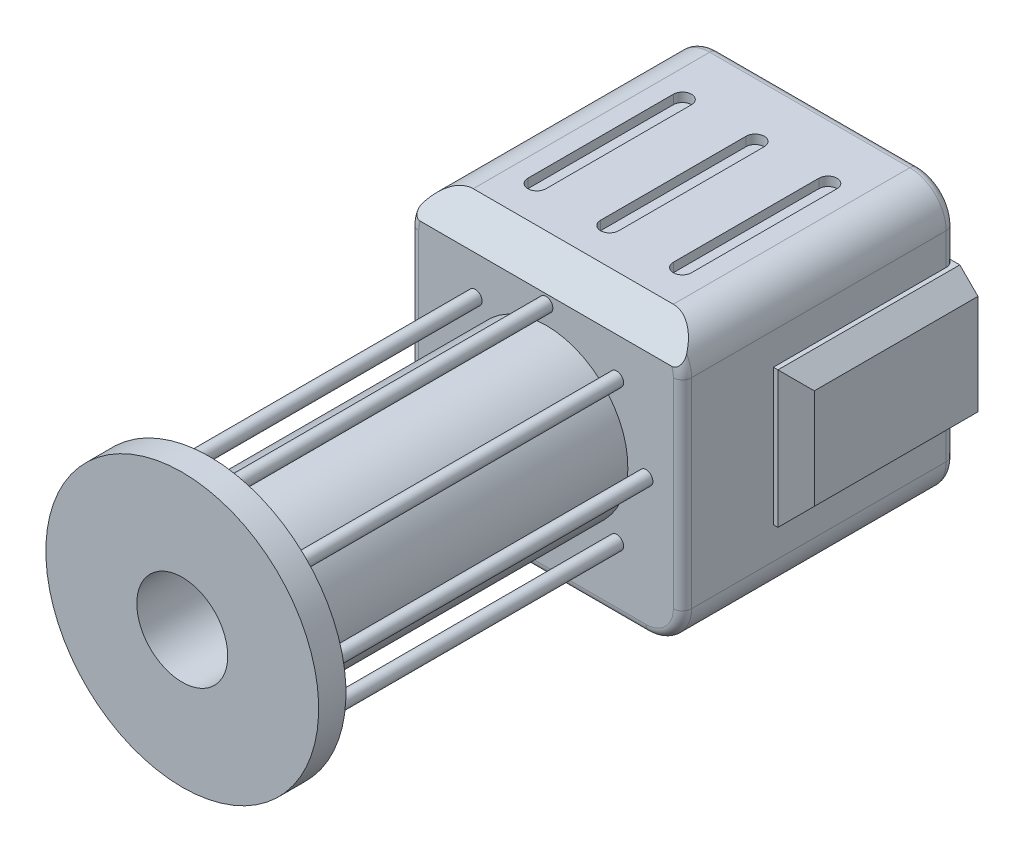
from build123d import *

# Parameters (mm, degrees)
SKETCH2_W           = 30
SKETCH2_H           = 30
BOSS_EXTRUDE1_DEPTH = 15
FILLET1_R           = 4
CHAMFER1_SIZE       = 3
FILLET2_R           = 1
SKETCH4_R           = 10
BOSS_EXTRUDE2_DEPTH = 5
FILLET3_R           = 5
SKETCH6_W           = 5
SKETCH6_H           = 15
BOSS_EXTRUDE3_DEPTH = 20
CHAMFER2_SIZE       = 2
SKETCH7_R           = 5
CUT_EXTRUDE1_DEPTH  = 10
SKETCH8_R           = 0.75
BOSS_EXTRUDE4_DEPTH = 40
CIRPATTERN1_COUNT   = 8
SKETCH10_R          = 5
CUT_EXTRUDE3_DEPTH  = 10
CUT_EXTRUDE4_DEPTH  = 1
LPATTERN1_COUNT     = 2
LPATTERN1_PITCH     = 8
LPATTERN1_COL_COUNT = 2
LPATTERN1_COL_PITCH = 8


# Some blends are built 0.0001 mm under size
with BuildPart() as part:
    # Sketch2 → Boss-Extrude1 (new, symmetric)
    with BuildSketch(Plane.XY):
        Rectangle(SKETCH2_W, SKETCH2_H)
    extrude(amount=BOSS_EXTRUDE1_DEPTH, both=True)

    # Sketch3 → Revolve1 (revolve)
    with BuildSketch(Plane(origin=(0, 0, 0), x_dir=(0, 0, -1), z_dir=(1, 0, 0))):
        Polygon((-15, 0), (-15, 9), (-52, 9), (-52, 15), (-55, 15), (-55, 0), align=None)
    revolve(axis=Axis((0, 0, 15), (0, 0, 1)))

    # Fillet1
    fillet1_edges = [part.edges().sort_by_distance(p)[0] for p in [
        (15, -15, 0),
        (-15, -15, 0),
        (-15, 15, 0),
        (15, 15, 0),
    ]]
    fillet(fillet1_edges, radius=FILLET1_R)

    # Chamfer1
    # the kernel refuses this chamfer: 3 mm, written as the material it takes off along each edge
    with BuildSketch(Plane(origin=(18.715048964, 15, 15), x_dir=(0, -0.9996219169112969, 0.02749587661058621), z_dir=(-1, 0, 0))) as chamfer1_piece_1:
        Polygon((CHAMFER1_SIZE * 0.999621916911, -CHAMFER1_SIZE * 0.0274958766106), (-CHAMFER1_SIZE * 0.0274958766106, -CHAMFER1_SIZE * 0.999621916911), (0, 0), align=None)
    extrude(amount=37.430097928, mode=Mode.SUBTRACT)

    # Fillet2
    fillet2_edges = [part.edges().sort_by_distance(p)[0] for p in [
        (-13.828427125, 13.828427125, -15),
        (0, 15, -15),
        (13.828427125, 13.828427125, -15),
        (15, 0, -15),
        (13.828427125, -13.828427125, -15),
        (0, -15, -15),
        (-13.828427125, -13.828427125, -15),
        (-14.968118785, 11.50401717, 15),
        (14.968118785, 11.50401717, 15),
        (15, 0, 15),
        (13.828427125, -13.828427125, 15),
        (0, -15, 15),
        (-13.828427125, -13.828427125, 15),
        (-15, 0, -15),
        (-15, 0, 15),
    ]]
    fillet(fillet2_edges, radius=FILLET2_R)

    # Sketch4 → Boss-Extrude2 (add)
    with BuildSketch(Plane(origin=(0, 0, -15), x_dir=(-1, 0, 0), z_dir=(0, 0, -1))):
        Circle(SKETCH4_R)
    extrude(amount=BOSS_EXTRUDE2_DEPTH)

    # Fillet3
    fillet3_edges = [part.edges().sort_by_distance(p)[0] for p in [
        (10, 0, -20),
    ]]
    fillet(fillet3_edges, radius=FILLET3_R - 0.0001)  # a hair under: the kernel refuses the full size

    # Sketch6 → Boss-Extrude3 (add)
    with BuildSketch(Plane(origin=(0, 0, -15), x_dir=(-1, 0, 0), z_dir=(0, 0, -1))):
        with Locations((-15, 0)):
            Rectangle(SKETCH6_W, SKETCH6_H)
    extrude(amount=-BOSS_EXTRUDE3_DEPTH)

    # Chamfer2
    chamfer2_edges = [part.edges().sort_by_distance(p)[0] for p in [
        (17.5, 7.5, -5),
        (17.5, 0, 5),
        (17.5, -7.5, -5),
    ]]
    chamfer(chamfer2_edges, length=CHAMFER2_SIZE)

    # Sketch7 → Cut-Extrude1 (cut)
    with BuildSketch(Plane.XY.offset(55)):
        Circle(SKETCH7_R)
    extrude(amount=-CUT_EXTRUDE1_DEPTH, mode=Mode.SUBTRACT)

    # Sketch8 → Boss-Extrude4 (add)
    with BuildSketch(Plane.XY.offset(55)):
        with Locations(Location((0, 11, 0), (0, 0, 90))):
            Circle(SKETCH8_R)
    boss_extrude4 = extrude(amount=-BOSS_EXTRUDE4_DEPTH)

    # CirPattern1: Boss-Extrude4 ×8 about axis
    cirpattern1_axis = Axis((0, 0, 0), (0, 0, 1))
    for i in range(1, CIRPATTERN1_COUNT):
        add(boss_extrude4.rotate(cirpattern1_axis, i * 360 / CIRPATTERN1_COUNT))

    # Sketch10 → Cut-Extrude3 (cut)
    with BuildSketch(Plane.ZY.offset(15)):
        Circle(SKETCH10_R)
    extrude(amount=-CUT_EXTRUDE3_DEPTH, mode=Mode.SUBTRACT)

    # Sketch11 → Cut-Extrude4 (cut)
    with BuildSketch(Plane(origin=(0, 15, 0), x_dir=(1, 0, 0), z_dir=(0, 1, 0))):
        with BuildLine():
            Line((-1, -8), (-1, 8))
            ThreePointArc((-1, 8), (0, 9), (1, 8))
            Line((1, 8), (1, -8))
            ThreePointArc((1, -8), (0, -9), (-1, -8))
        make_face()
    cut_extrude4 = extrude(amount=-CUT_EXTRUDE4_DEPTH, mode=Mode.SUBTRACT)

    # LPattern1: Cut-Extrude4 ×2
    with Locations(*[(i * LPATTERN1_PITCH, 0, 0) for i in range(1, LPATTERN1_COUNT)]):
        add(cut_extrude4, mode=Mode.SUBTRACT)

    # LPattern1 col: Cut-Extrude4 ×2
    with Locations(*[(-i * LPATTERN1_COL_PITCH, 0, 0) for i in range(1, LPATTERN1_COL_COUNT)]):
        add(cut_extrude4, mode=Mode.SUBTRACT)


solid = part.part
